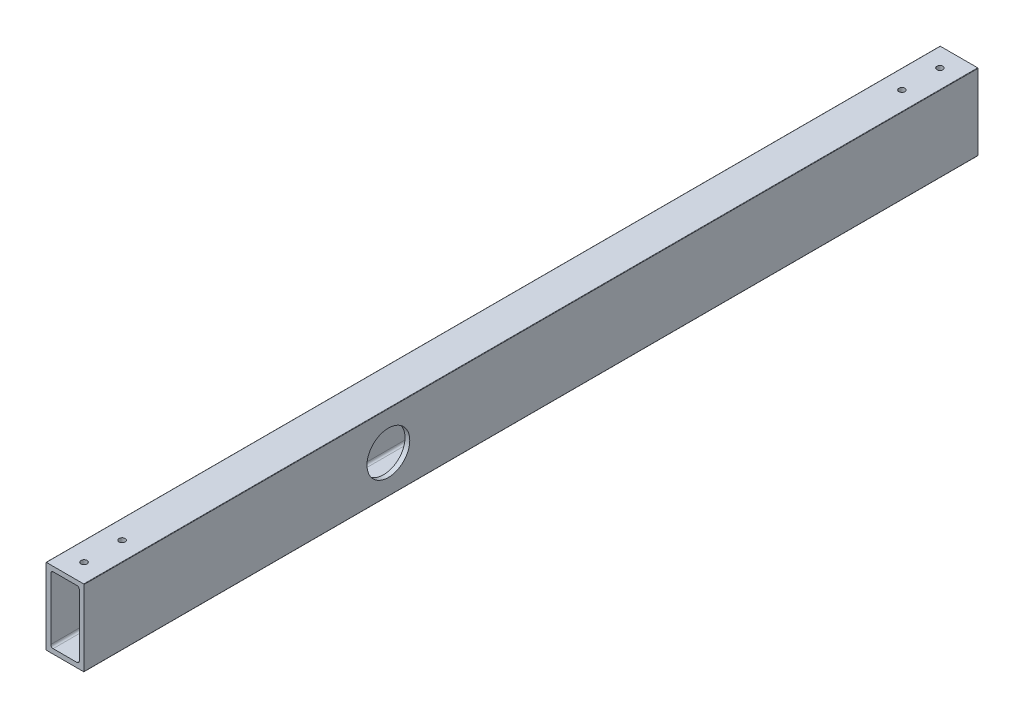
from build123d import *

# Parameters (mm, degrees)
BOSS_EXTRUDE1_DEPTH = 596.9
SKETCH2_R           = 2.032
CUT_EXTRUDE1_DEPTH  = 600.596039013
SKETCH5_R           = 14.2875
CUT_EXTRUDE2_DEPTH  = 600.596039013


with BuildPart() as part:
    # Sketch1 → Boss-Extrude1 (new body)
    with BuildSketch(Plane(origin=(0, 0, 0), x_dir=(-1, 0, 0), z_dir=(0, 0, -1))):
        with BuildLine():
            Line((0, 0.254), (0, 50.546))
            ThreePointArc((0, 50.546), (-0.074394878, 50.725605122), (-0.254, 50.8))
            Line((-0.254, 50.8), (-25.146, 50.8))
            ThreePointArc((-25.146, 50.8), (-25.325605122, 50.725605122), (-25.4, 50.546))
            Line((-25.4, 50.546), (-25.4, 0.254))
            ThreePointArc((-25.4, 0.254), (-25.325605122, 0.074394878), (-25.146, 0))
            Line((-25.146, 0), (-0.254, 0))
            ThreePointArc((-0.254, 0), (-0.074394878, 0.074394878), (0, 0.254))
        make_face()
        with BuildLine():
            Line((-3.175, 46.0375), (-3.175, 4.7625))
            ThreePointArc((-3.175, 4.7625), (-3.639967985, 3.639967985), (-4.7625, 3.175))
            Line((-4.7625, 3.175), (-20.6375, 3.175))
            ThreePointArc((-20.6375, 3.175), (-21.760032015, 3.639967985), (-22.225, 4.7625))
            Line((-22.225, 4.7625), (-22.225, 46.0375))
            ThreePointArc((-22.225, 46.0375), (-21.760032015, 47.160032015), (-20.6375, 47.625))
            Line((-20.6375, 47.625), (-4.7625, 47.625))
            ThreePointArc((-4.7625, 47.625), (-3.639967985, 47.160032015), (-3.175, 46.0375))
        make_face(mode=Mode.SUBTRACT)
    extrude(amount=-BOSS_EXTRUDE1_DEPTH)

    # Sketch2 → Cut-Extrude1 (cut, through all)
    with BuildSketch(Plane(origin=(0, 50.8, 0), x_dir=(1, 0, 0), z_dir=(0, 1, 0))):
        with Locations((12.7, -584.2)):
            Circle(SKETCH2_R)
        with Locations((12.7, -558.8)):
            Circle(SKETCH2_R)
        with Locations((12.7, -38.1)):
            Circle(SKETCH2_R)
        with Locations((12.7, -12.7)):
            Circle(SKETCH2_R)
    extrude(amount=-CUT_EXTRUDE1_DEPTH, mode=Mode.SUBTRACT)

    # Sketch5 → Cut-Extrude2 (cut, through all)
    with BuildSketch(Plane(origin=(25.4, 0, 0), x_dir=(0, 0, -1), z_dir=(1, 0, 0))):
        with Locations((-393.7, 25.146)):
            Circle(SKETCH5_R)
    extrude(amount=-CUT_EXTRUDE2_DEPTH, mode=Mode.SUBTRACT)


solid = part.part
